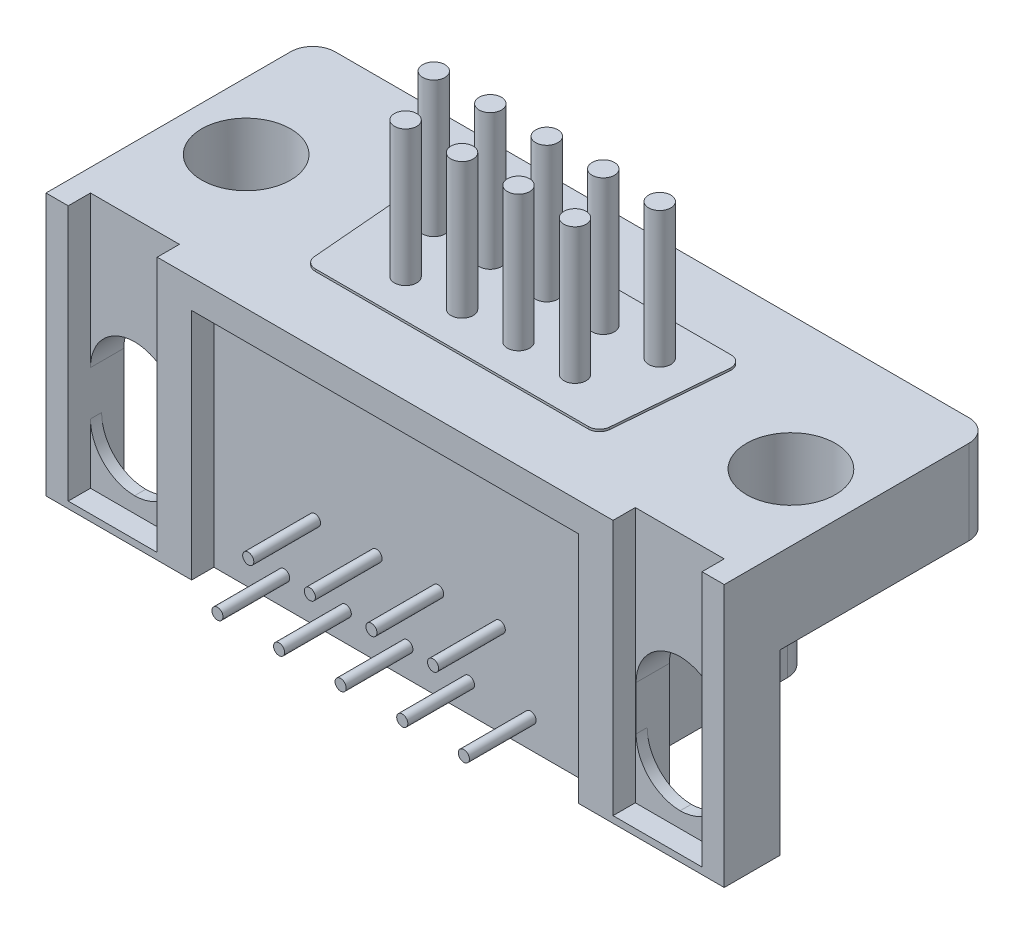
from build123d import *

# Parameters (mm, degrees)
SKETCH_1_W          = 30.5
SKETCH_1_H          = 12
EXTRUDE_1_DEPTH     = 18
SKETCH_2_W          = 30.5
SKETCH_2_H          = 12
CUT_EXTRUDE_2_DEPTH = 6.2
SKETCH_3_R          = 2
SKETCH_3_W          = 4
SKETCH_3_H          = 1
CUT_EXTRUDE_3_DEPTH = 11.5
CUT_EXTRUDE_4_DEPTH = 8
SKETCH_5_W          = 3.964363922
SKETCH_5_H          = 1
CUT_EXTRUDE_6_DEPTH = 7
SKETCH_6_W          = 3.964363922
SKETCH_6_H          = 6
CUT_EXTRUDE_7_DEPTH = 26.822712871
FILLET_1_R          = 2
FILLET_2_R          = 2
FILLET_3_R          = 1
SKETCH_7_W          = 17.4
SKETCH_7_H          = 5.750693342
CUT_EXTRUDE_8_DEPTH = 10.5
SKETCH_9_OUTSIDE_W  = 39.978
SKETCH_9_OUTSIDE_H  = 21.478
SKETCH_9_OUTSIDE_R  = 0.5
CUT_EXTRUDE_9_DEPTH = 6.1
SKETCH_8_R          = 0.25
EXTRUDE_2_DEPTH     = 3


with BuildPart() as part:
    # 草图1 → 凸台-拉伸1 (new body)
    with BuildSketch(Plane(origin=(0, 0, 0), x_dir=(1, 0, 0), z_dir=(0, 1, 0))):
        Rectangle(SKETCH_1_W, SKETCH_1_H)
    extrude(amount=EXTRUDE_1_DEPTH)

    # 草图2 → 切除-拉伸2 (cut)
    with BuildSketch(Plane(origin=(0, 18, 0), x_dir=(1, 0, 0), z_dir=(0, 1, 0))):
        Rectangle(SKETCH_2_W, SKETCH_2_H)
        with BuildLine():
            Line((-6.556600226, 3), (6.556600226, 3))
            ThreePointArc((6.556600226, 3), (6.924541369, 2.838554744), (7.054873105, 2.45847726))
            Line((7.054873105, 2.45847726), (6.638206438, -2.54152274))
            ThreePointArc((6.638206438, -2.54152274), (6.478488304, -2.867941143), (6.139933559, -3))
            Line((6.139933559, -3), (-6.139933559, -3))
            ThreePointArc((-6.139933559, -3), (-6.478488304, -2.867941143), (-6.638206438, -2.54152274))
            Line((-6.638206438, -2.54152274), (-7.054873105, 2.45847726))
            ThreePointArc((-7.054873105, 2.45847726), (-6.924541369, 2.838554744), (-6.556600226, 3))
        make_face(mode=Mode.SUBTRACT)
    extrude(amount=-CUT_EXTRUDE_2_DEPTH, mode=Mode.SUBTRACT)

    # 草图3 → 切除-拉伸3 (cut)
    with BuildSketch(Plane(origin=(0, 11.8, 0), x_dir=(1, 0, 0), z_dir=(0, 1, 0))):
        with Locations(Location((12.25, 0, 0), (0, 0, 270))):
            Circle(SKETCH_3_R)
        with Locations(Location((-12.25, 0, 0), (0, 0, 90))):
            Circle(SKETCH_3_R)
        with Locations((12.25, -5.5)):
            Rectangle(SKETCH_3_W, SKETCH_3_H)
        with Locations((-12.25, -5.5)):
            Rectangle(SKETCH_3_W, SKETCH_3_H)
    extrude(amount=-CUT_EXTRUDE_3_DEPTH, mode=Mode.SUBTRACT)

    # 草图4 → 切除-拉伸4 (cut)
    with BuildSketch(Plane.XZ):
        Polygon((8.5, -4.6), (8.5, 3.5), (15.25, 3.5), (15.25, -4.6), (15.25, -6), (-15.25, -6), (-15.25, 3.5), (-8.5, 3.5), (-8.5, -4.6), align=None)
    extrude(amount=-CUT_EXTRUDE_4_DEPTH, mode=Mode.SUBTRACT)

    # 草图5 → 切除-拉伸6 (cut)
    with BuildSketch(Plane.XZ):
        with Locations((12.267818039, 4)):
            Rectangle(SKETCH_5_W, SKETCH_5_H)
        with Locations((-12.267818039, 4)):
            Rectangle(SKETCH_5_W, SKETCH_5_H)
    extrude(amount=-CUT_EXTRUDE_6_DEPTH, mode=Mode.SUBTRACT)

    # 草图6 → 切除-拉伸7 (cut, through all)
    with BuildSketch(Plane(origin=(0, 0, 4.5), x_dir=(-1, 0, 0), z_dir=(0, 0, -1))):
        with Locations((12.267818039, 4)):
            Rectangle(SKETCH_6_W, SKETCH_6_H)
    cut_extrude_7 = extrude(amount=-CUT_EXTRUDE_7_DEPTH, mode=Mode.SUBTRACT)

    # 圆角1
    # the kernel refuses this fillet: 2 mm, written as the material it adds along each edge
    with BuildSketch(Plane(origin=(-14.25, 1, 4.5), x_dir=(0, 1, 0), z_dir=(0, 0, 1)), Plane(origin=(-10.285636078, 1, 4.5), x_dir=(-1, 0, 0), z_dir=(0, 0, 1))) as fillet_1_piece_1:
        with BuildLine():
            CenterArc((FILLET_1_R, -FILLET_1_R), FILLET_1_R, 90, 90)
            Line((0, -FILLET_1_R), (0, 0))
            Line((0, 0), (FILLET_1_R, 0))
        make_face()
    extrude(amount=0.5)
    with BuildSketch(Plane(origin=(-14.25, 7, 3.5), x_dir=(0, -1, 0), z_dir=(0, 0, 1))) as fillet_1_piece_2:
        with BuildLine():
            CenterArc((FILLET_1_R, FILLET_1_R), FILLET_1_R, 180, 90)
            Line((0, FILLET_1_R), (0, 0))
            Line((0, 0), (FILLET_1_R, 0))
        make_face()
    extrude(amount=1.5)
    with BuildSketch(Plane(origin=(-10.285636078, 7, 3.5), x_dir=(0, -1, 0), z_dir=(0, 0, 1))) as fillet_1_piece_3:
        with BuildLine():
            CenterArc((FILLET_1_R, -FILLET_1_R), FILLET_1_R, 90, 90)
            Line((0, -FILLET_1_R), (0, 0))
            Line((0, 0), (FILLET_1_R, 0))
        make_face()
    extrude(amount=1.5)

    # 镜向1: 切除-拉伸7 across plane
    add(cut_extrude_7.mirror(Plane(origin=(0, 0, 0), x_dir=(0, 0, 1), z_dir=(1, 0, 0))), mode=Mode.SUBTRACT)

    # 圆角2
    # the kernel refuses this fillet: 2 mm, written as the material it adds along each edge
    with BuildSketch(Plane(origin=(14.25, 1, 4.5), x_dir=(-1, 0, 0), z_dir=(0, 0, 1))) as fillet_2_piece_1:
        with BuildLine():
            CenterArc((FILLET_2_R, -FILLET_2_R), FILLET_2_R, 90, 90)
            Line((0, -FILLET_2_R), (0, 0))
            Line((0, 0), (FILLET_2_R, 0))
        make_face()
    extrude(amount=0.5)
    with BuildSketch(Plane(origin=(10.285636078, 1, 4.5), x_dir=(1, 0, 0), z_dir=(0, 0, 1))) as fillet_2_piece_2:
        with BuildLine():
            CenterArc((FILLET_2_R, FILLET_2_R), FILLET_2_R, 180, 90)
            Line((0, FILLET_2_R), (0, 0))
            Line((0, 0), (FILLET_2_R, 0))
        make_face()
    extrude(amount=0.5)
    with BuildSketch(Plane(origin=(10.285636078, 7, 3.5), x_dir=(1, 0, 0), z_dir=(0, 0, 1)), Plane(origin=(14.25, 7, 5), x_dir=(-1, 0, 0), z_dir=(0, 0, -1))) as fillet_2_piece_3:
        with BuildLine():
            CenterArc((FILLET_2_R, -FILLET_2_R), FILLET_2_R, 90, 90)
            Line((0, -FILLET_2_R), (0, 0))
            Line((0, 0), (FILLET_2_R, 0))
        make_face()
    extrude(amount=1.5)

    # 圆角3
    fillet_3_edges = [part.edges().sort_by_distance(p)[0] for p in [
        (-15.25, 9.9, -6),
        (15.25, 9.9, -6),
        (-8.5, 4, -4.6),
        (8.5, 4, -4.6),
    ]]
    fillet(fillet_3_edges, radius=FILLET_3_R)

    # 草图7 → 切除-拉伸8 (cut)
    with BuildSketch(Plane.XZ):
        with Locations((0, 7.875346671)):
            Rectangle(SKETCH_7_W, SKETCH_7_H)
    extrude(amount=-CUT_EXTRUDE_8_DEPTH, mode=Mode.SUBTRACT)

    # 草图9 outside → 切除-拉伸9 (cut)
    with BuildSketch(Plane(origin=(0, 18, 0), x_dir=(1, 0, 0), z_dir=(0, 1, 0))):
        Rectangle(SKETCH_9_OUTSIDE_W, SKETCH_9_OUTSIDE_H)
        with Locations(Location((0, 1.27, 0), (0, 0, 270))):
            Circle(SKETCH_9_OUTSIDE_R, mode=Mode.SUBTRACT)
        with Locations(Location((2.54, 1.27, 0), (0, 0, 270))):
            Circle(SKETCH_9_OUTSIDE_R, mode=Mode.SUBTRACT)
        with Locations(Location((5.08, 1.27, 0), (0, 0, 270))):
            Circle(SKETCH_9_OUTSIDE_R, mode=Mode.SUBTRACT)
        with Locations(Location((-5.08, 1.27, 0), (0, 0, 90))):
            Circle(SKETCH_9_OUTSIDE_R, mode=Mode.SUBTRACT)
        with Locations(Location((-2.54, 1.27, 0), (0, 0, 90))):
            Circle(SKETCH_9_OUTSIDE_R, mode=Mode.SUBTRACT)
        with Locations(Location((-1.27, -1.27, 0), (0, 0, 270))):
            Circle(SKETCH_9_OUTSIDE_R, mode=Mode.SUBTRACT)
        with Locations(Location((-3.81, -1.27, 0), (0, 0, 270))):
            Circle(SKETCH_9_OUTSIDE_R, mode=Mode.SUBTRACT)
        with Locations(Location((3.81, -1.27, 0), (0, 0, 90))):
            Circle(SKETCH_9_OUTSIDE_R, mode=Mode.SUBTRACT)
        with Locations(Location((1.27, -1.27, 0), (0, 0, 90))):
            Circle(SKETCH_9_OUTSIDE_R, mode=Mode.SUBTRACT)
    extrude(amount=-CUT_EXTRUDE_9_DEPTH, mode=Mode.SUBTRACT)

    # 草图8 → 凸台-拉伸2 (add)
    with BuildSketch(Plane.XY.offset(5)):
        with Locations(Location((0, 1.27, 0), (0, 0, 180))):
            Circle(SKETCH_8_R)
        with Locations(Location((2.77, 1.27, 0), (0, 0, 180))):
            Circle(SKETCH_8_R)
        with Locations(Location((5.54, 1.27, 0), (0, 0, 180))):
            Circle(SKETCH_8_R)
        with Locations(Location((-5.54, 1.27, 0), (0, 0, 180))):
            Circle(SKETCH_8_R)
        with Locations(Location((-2.77, 1.27, 0), (0, 0, 180))):
            Circle(SKETCH_8_R)
        with Locations(Location((-1.385, 4.11, 0), (0, 0, 180))):
            Circle(SKETCH_8_R)
        with Locations(Location((1.385, 4.11, 0), (0, 0, 180))):
            Circle(SKETCH_8_R)
        with Locations(Location((-4.155, 4.11, 0), (0, 0, 180))):
            Circle(SKETCH_8_R)
        with Locations(Location((4.155, 4.11, 0), (0, 0, 180))):
            Circle(SKETCH_8_R)
    extrude(amount=EXTRUDE_2_DEPTH)


solid = part.part
